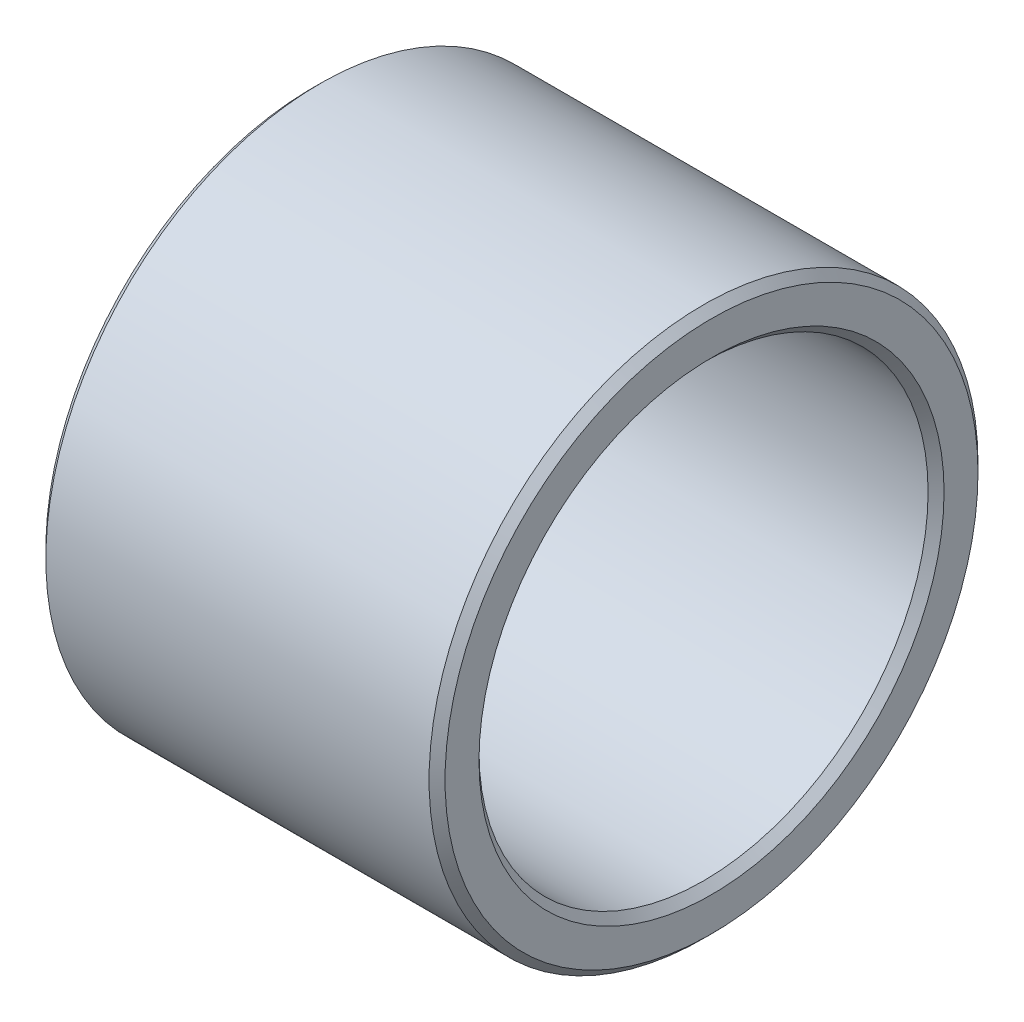
from build123d import *

# Parameters (mm, degrees)
SKETCH1_R           = 17.4625
SKETCH1_R_2         = 14.2875
BOSS_EXTRUDE1_DEPTH = 25.4
CHAMFER1_SIZE       = 0.508


with BuildPart() as part:
    # Sketch1 → Boss-Extrude1 (new body)
    with BuildSketch(Plane(origin=(0, 0, 0), x_dir=(0, 0, -1), z_dir=(1, 0, 0))):
        Circle(SKETCH1_R)
        Circle(SKETCH1_R_2, mode=Mode.SUBTRACT)
    extrude(amount=BOSS_EXTRUDE1_DEPTH)

    # Chamfer1
    chamfer1_edges = [part.edges().sort_by_distance(p)[0] for p in [
        (25.4, 0, 14.2875),
        (25.4, 0, 17.4625),
        (0, 0, 17.4625),
        (0, 0, 14.2875),
    ]]
    chamfer(chamfer1_edges, length=CHAMFER1_SIZE)


solid = part.part
